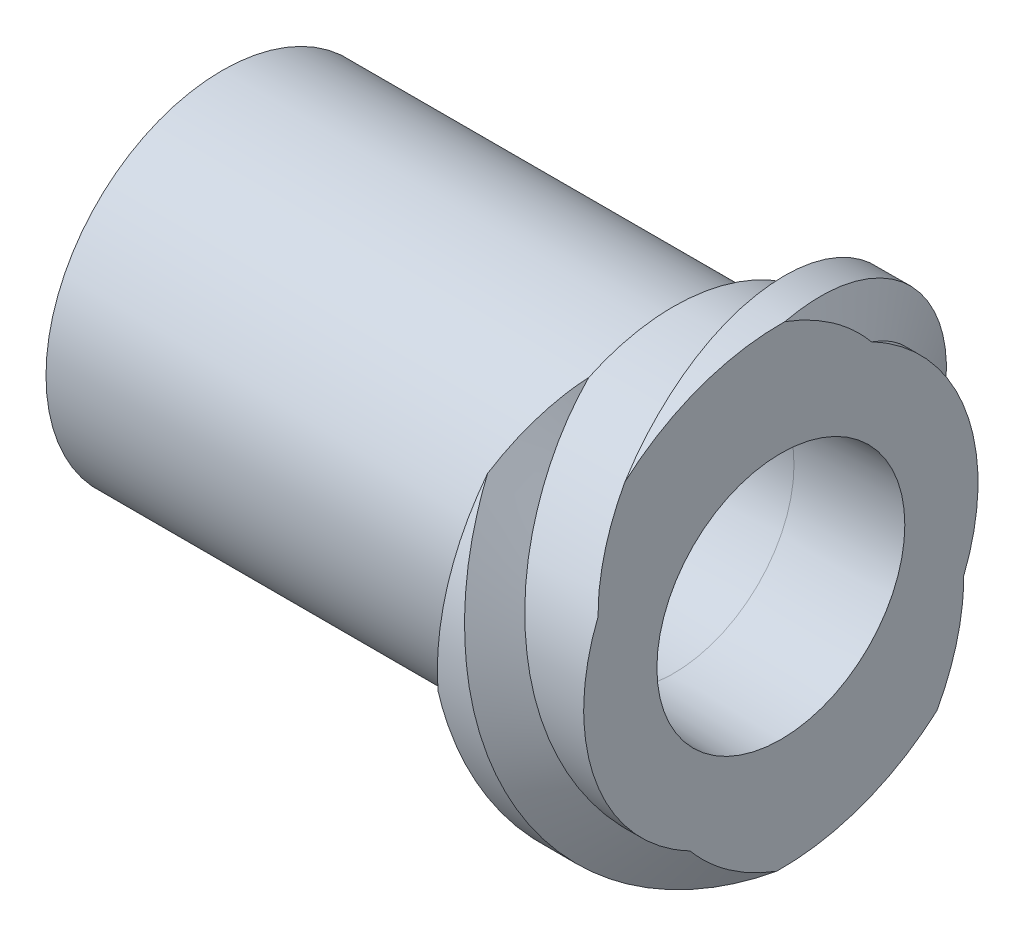
from build123d import *

# Parameters (mm, degrees)
ESQUISSE2_OUTSIDE_W                   = 16.214
ESQUISSE2_OUTSIDE_H                   = 16.214
ENL_V_MAT_EXTRU_1_DEPTH               = 17.967468874
ENL_VEMENT_DE_MATI_RE_BALAYAGE2_PITCH = 5.1
R_P_TITION_CIRCULAIRE1_COUNT          = 2
ENL_VEMENT_DE_MATI_RE_BALAYAGE3_PITCH = 0.85
CONG_1_R                              = 0.2
SCALE1_SCALE                          = 1.05


with BuildPart() as part:
    # Esquisse1 → Révolution1 (revolve)
    with BuildSketch(Plane.XY, mode=Mode.PRIVATE) as r_volution1_sk:
        Polygon((10.309090909, 2.95), (5.709090909, 2.95), (5.709090909, 4.55), (3.309090909, 4.55), (2.309090909, 3.175), (-3.190909091, 3.175), (-3.190909091, 1.4), (-4.490909091, 1.075), (-5.690909091, 1.075), (-5.690909091, 1.3), (-8.690909091, 0.85), (-9.990909091, 0.85), (-9.990909091, 0.5), (3.759090909, 0.5), (3.759090909, 1.920326087), (5.709090909, 1.95), (10.309090909, 2.02), (12.109090909, 2.075), (12.109090909, 3.95), (10.309090909, 3.95), align=None)
    revolve(r_volution1_sk.sketch.rotate(Axis((13.255472394, 0, 0), (-1, 0, 0)), 90), axis=Axis((13.255472394, 0, 0), (-1, 0, 0)))

    # Esquisse2 outside → Enlèv. mat.-Extru.1 (cut, through all)
    with BuildSketch(Plane(origin=(5.709090909, 0, 0), x_dir=(0, 0, -1), z_dir=(1, 0, 0))):
        Rectangle(ESQUISSE2_OUTSIDE_W, ESQUISSE2_OUTSIDE_H)
        Polygon((0, -4.618802154), (4, -2.309401077), (4, 2.309401077), (0, 4.618802154), (-4, 2.309401077), (-4, -2.309401077), align=None, mode=Mode.SUBTRACT)
    extrude(amount=-ENL_V_MAT_EXTRU_1_DEPTH, mode=Mode.SUBTRACT)

    # Enlèvement de matière-Balayage2: the profile of Esquisse5 screwed along a right-hand helix of 1.2 turns, 12 arcs to a turn; built about Z, then put on its axis
    enl_vement_de_mati_re_balayage2_z = Axis((0, 0, 0), (0, 0, 1))
    enl_vement_de_mati_re_balayage2_corners = [(4.45, 0, 0), (3.3, 0, -0.66395281), (3.3, 0, -1.86395281), (4.45, 0, -2.527905619)]
    with BuildLine(mode=Mode.PRIVATE) as enl_vement_de_mati_re_balayage2_profile:
        Line(enl_vement_de_mati_re_balayage2_corners[0], enl_vement_de_mati_re_balayage2_corners[1])
        Line(enl_vement_de_mati_re_balayage2_corners[1], enl_vement_de_mati_re_balayage2_corners[2])
        Line(enl_vement_de_mati_re_balayage2_corners[2], enl_vement_de_mati_re_balayage2_corners[3])
        Line(enl_vement_de_mati_re_balayage2_corners[3], enl_vement_de_mati_re_balayage2_corners[0])
    enl_vement_de_mati_re_balayage2_cap = Face(enl_vement_de_mati_re_balayage2_profile.wire())
    enl_vement_de_mati_re_balayage2_turn_angles = [0, 15, 30, 45, 60, 75, 90, 105, 120, 135, 150, 165, 180, 195, 210, 225, 240, 255, 270, 285, 300, 315, 330, 345, 360]
    enl_vement_de_mati_re_balayage2_turn_weights = [1, 0.9659258262890683, 1, 0.9659258262890683, 1, 0.9659258262890683, 1, 0.9659258262890683, 1, 0.9659258262890683, 1, 0.9659258262890683, 1, 0.9659258262890683, 1, 0.9659258262890683, 1, 0.9659258262890683, 1, 0.9659258262890683, 1, 0.9659258262890683, 1, 0.9659258262890683, 1]
    enl_vement_de_mati_re_balayage2_turn_rails = [Edge.make_bspline([Vector(p[0], p[1], 0).rotate(enl_vement_de_mati_re_balayage2_z, enl_vement_de_mati_re_balayage2_turn_angles[k]) / enl_vement_de_mati_re_balayage2_turn_weights[k] + Vector(0, 0, p[2] + ENL_VEMENT_DE_MATI_RE_BALAYAGE2_PITCH * enl_vement_de_mati_re_balayage2_turn_angles[k] / 360) for k in range(25)], [0, 0, 0, 1, 1, 2, 2, 3, 3, 4, 4, 5, 5, 6, 6, 7, 7, 8, 8, 9, 9, 10, 10, 11, 11, 12, 12, 12], 2, enl_vement_de_mati_re_balayage2_turn_weights) for p in enl_vement_de_mati_re_balayage2_corners]
    enl_vement_de_mati_re_balayage2_turn_sides = [Face.make_surface_from_curves(enl_vement_de_mati_re_balayage2_turn_rails[p[0]], enl_vement_de_mati_re_balayage2_turn_rails[p[1]]) for p in [(0, 1), (1, 2), (2, 3), (3, 0)]]
    enl_vement_de_mati_re_balayage2_last_angles = [360, 375, 390, 405, 420, 426, 432]
    enl_vement_de_mati_re_balayage2_last_weights = [1, 0.9659258262890683, 1, 0.9659258262890683, 1, 0.9945218953682725, 1]
    enl_vement_de_mati_re_balayage2_last_rails = [Edge.make_bspline([Vector(p[0], p[1], 0).rotate(enl_vement_de_mati_re_balayage2_z, enl_vement_de_mati_re_balayage2_last_angles[k]) / enl_vement_de_mati_re_balayage2_last_weights[k] + Vector(0, 0, p[2] + ENL_VEMENT_DE_MATI_RE_BALAYAGE2_PITCH * enl_vement_de_mati_re_balayage2_last_angles[k] / 360) for k in range(7)], [0, 0, 0, 1, 1, 2, 2, 3, 3, 3], 2, enl_vement_de_mati_re_balayage2_last_weights) for p in enl_vement_de_mati_re_balayage2_corners]
    enl_vement_de_mati_re_balayage2_last_sides = [Face.make_surface_from_curves(enl_vement_de_mati_re_balayage2_last_rails[p[0]], enl_vement_de_mati_re_balayage2_last_rails[p[1]]) for p in [(0, 1), (1, 2), (2, 3), (3, 0)]]
    enl_vement_de_mati_re_balayage2 = Plane(origin=(13.109090909, 0, 0), x_dir=(0, 0, -1), z_dir=(-1, 0, 0)) * Solid(Shell([*enl_vement_de_mati_re_balayage2_turn_sides, *enl_vement_de_mati_re_balayage2_last_sides, enl_vement_de_mati_re_balayage2_cap, enl_vement_de_mati_re_balayage2_cap.rotate(enl_vement_de_mati_re_balayage2_z, 432).moved(Location((0, 0, ENL_VEMENT_DE_MATI_RE_BALAYAGE2_PITCH * 432 / 360)))]))
    add(enl_vement_de_mati_re_balayage2, mode=Mode.SUBTRACT)

    # Répétition circulaire1: Enlèvement de matière-Balayage2 ×2 about axis
    r_p_tition_circulaire1_axis = Axis((3.759090909, 0, 0), (1, 0, 0))
    for i in range(1, R_P_TITION_CIRCULAIRE1_COUNT):
        add(enl_vement_de_mati_re_balayage2.rotate(r_p_tition_circulaire1_axis, i * 360 / R_P_TITION_CIRCULAIRE1_COUNT), mode=Mode.SUBTRACT)

    # Esquisse6 → Enlèvement de matière-Révolution2 (revolve, cut)
    with BuildSketch(Plane(origin=(0, 0, 0), x_dir=(1, 0, 0), z_dir=(0, 0, -1)), mode=Mode.PRIVATE) as enl_vement_de_mati_re_r_volution2_sk:
        with BuildLine():
            Line((5.209090909, 4.598364037), (5.709090909, 4.598364037))
            Line((5.709090909, 4.598364037), (5.709090909, 2.95))
            ThreePointArc((5.709090909, 2.95), (5.581340735, 3.811264187), (5.209090909, 4.598364037))
        make_face()
        Polygon((2.309090909, -3.175), (-3.190909091, -2.95), (-3.190909091, -3.175), align=None)
    revolve(enl_vement_de_mati_re_r_volution2_sk.sketch.rotate(Axis((-1.819283659, 0, 0), (1, 0, 0)), 270), axis=Axis((-1.819283659, 0, 0), (1, 0, 0)), mode=Mode.SUBTRACT)


with BuildPart() as body_2:
    # Fractionner1: the piece on the far side of the plane
    add(part.part)
    split(bisect_by=Plane(origin=(2.309090909, 0, 0), x_dir=(0, 0, 1), z_dir=(1, 0, 0)), keep=Keep.BOTTOM)

    # Enlèvement de matière-Balayage3: the profile of Esquisse8 screwed along a right-hand helix of 12 turns, 8 arcs to a turn; built about Z, then put on its axis
    enl_vement_de_mati_re_balayage3_z = Axis((0, 0, 0), (0, 0, 1))
    enl_vement_de_mati_re_balayage3_corners = [(2.65, 0, -0.05), (2.65, 0, 0.05), (3.3433932, 0, 0.5), (3.3433932, 0, -0.5)]
    with BuildLine(mode=Mode.PRIVATE) as enl_vement_de_mati_re_balayage3_profile:
        Line(enl_vement_de_mati_re_balayage3_corners[0], enl_vement_de_mati_re_balayage3_corners[1])
        Line(enl_vement_de_mati_re_balayage3_corners[1], enl_vement_de_mati_re_balayage3_corners[2])
        Line(enl_vement_de_mati_re_balayage3_corners[2], enl_vement_de_mati_re_balayage3_corners[3])
        Line(enl_vement_de_mati_re_balayage3_corners[3], enl_vement_de_mati_re_balayage3_corners[0])
    enl_vement_de_mati_re_balayage3_cap = Face(enl_vement_de_mati_re_balayage3_profile.wire())
    enl_vement_de_mati_re_balayage3_turn_angles = [0, 22.5, 45, 67.5, 90, 112.5, 135, 157.5, 180, 202.5, 225, 247.5, 270, 292.5, 315, 337.5, 360]
    enl_vement_de_mati_re_balayage3_turn_weights = [1, 0.9238795325112867, 1, 0.9238795325112867, 1, 0.9238795325112867, 1, 0.9238795325112867, 1, 0.9238795325112867, 1, 0.9238795325112867, 1, 0.9238795325112867, 1, 0.9238795325112867, 1]
    enl_vement_de_mati_re_balayage3_turn_rails = [Edge.make_bspline([Vector(p[0], p[1], 0).rotate(enl_vement_de_mati_re_balayage3_z, enl_vement_de_mati_re_balayage3_turn_angles[k]) / enl_vement_de_mati_re_balayage3_turn_weights[k] + Vector(0, 0, p[2] + ENL_VEMENT_DE_MATI_RE_BALAYAGE3_PITCH * enl_vement_de_mati_re_balayage3_turn_angles[k] / 360) for k in range(17)], [0, 0, 0, 1, 1, 2, 2, 3, 3, 4, 4, 5, 5, 6, 6, 7, 7, 8, 8, 8], 2, enl_vement_de_mati_re_balayage3_turn_weights) for p in enl_vement_de_mati_re_balayage3_corners]
    enl_vement_de_mati_re_balayage3_turn_sides = [Face.make_surface_from_curves(enl_vement_de_mati_re_balayage3_turn_rails[p[0]], enl_vement_de_mati_re_balayage3_turn_rails[p[1]]) for p in [(0, 1), (1, 2), (2, 3), (3, 0)]]
    enl_vement_de_mati_re_balayage3 = Plane(origin=(-4.190909091, 0, 0), x_dir=(0, 0, 1), z_dir=(1, 0, 0)) * Solid(Shell([*[p.moved(Location((0, 0, ENL_VEMENT_DE_MATI_RE_BALAYAGE3_PITCH * i))) for i in range(12) for p in enl_vement_de_mati_re_balayage3_turn_sides], enl_vement_de_mati_re_balayage3_cap, enl_vement_de_mati_re_balayage3_cap.rotate(enl_vement_de_mati_re_balayage3_z, 4320).moved(Location((0, 0, ENL_VEMENT_DE_MATI_RE_BALAYAGE3_PITCH * 4320 / 360)))]))
    add(enl_vement_de_mati_re_balayage3, mode=Mode.SUBTRACT)


with BuildPart() as part_1:
    add(part.part)

    # Fractionner1
    split(bisect_by=Plane(origin=(2.309090909, 0, 0), x_dir=(0, 0, 1), z_dir=(1, 0, 0)), keep=Keep.TOP)


with BuildPart() as body_2_1:
    add(body_2.part)

    # Combiner1: union part
    add(part_1.part)

    # Congé1
    cong_1_edges = [body_2_1.edges().sort_by_distance(p)[0] for p in [
        (5.709090909, -2.95, 0),
        (-3.190909091, 0, 1.4),
    ]]
    fillet(cong_1_edges, radius=CONG_1_R)

    # Sketch1 → Cut-Revolve1 (revolve, cut)
    with BuildSketch(Plane(origin=(0, 0, 0), x_dir=(1, 0, 0), z_dir=(0, 1, 0))):
        Polygon((2.759090909, 2.95), (10.307039448, 2.95), (10.307039448, 5.53408659), (-10.725109123, 5.53408659), (-10.725109123, 0.335117348), (2.759090909, 0.335117348), align=None)
        Polygon((10.307039448, -6.163499881), (10.307039448, -2.95), (2.759090909, -2.95), (2.759090909, 0), (-10.725109123, 0), (-10.725109123, -6.163499881), align=None)
    revolve(axis=Axis((-11.213736174, 0, 0), (1, 0, 0)), mode=Mode.SUBTRACT)


with BuildPart() as body_2_2:
    # Scale1: scaled about (7.582829496, 8.827e-06, -7.484e-06)
    add(body_2_1.part.scale(SCALE1_SCALE).moved(Location((-0.379141475, -4.41e-07, 3.74e-07))))


solid = body_2_2.part
